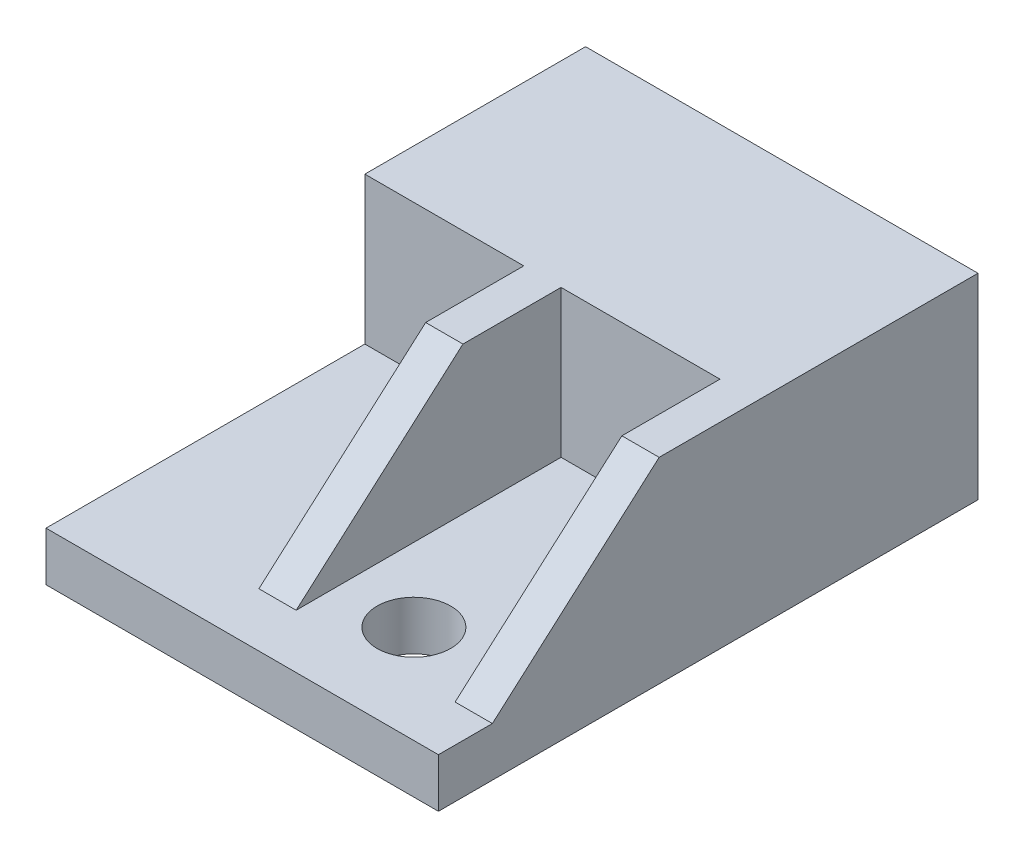
from build123d import *

# Parameters (mm, degrees)
BOSS_EXTRUDE3_DEPTH = 50.8
SKETCH1_7_R         = 9.525
BOSS_EXTRUDE5_DEPTH = 12.7
BOSS_EXTRUDE6_DEPTH = 9.652
SKETCH7_W           = 88.9
SKETCH7_H           = 44.45
CUT_EXTRUDE1_DEPTH  = 44.45
BOSS_EXTRUDE7_DEPTH = 9.652


with BuildPart() as part:
    # Sketch1 → Boss-Extrude3 (new body)
    with BuildSketch(Plane(origin=(0, 0, 0), x_dir=(1, 0, 0), z_dir=(0, 1, 0))):
        Polygon((0, 139.7), (-101.6, 139.7), (-101.6, 82.55), (-60.452, 82.55), (-60.452, 57.15), (-50.8, 57.15), (-50.8, 82.55), (-9.652, 82.55), (-9.652, 57.15), (0, 57.15), (0, 82.55), align=None)
    extrude(amount=BOSS_EXTRUDE3_DEPTH)

    # Sketch1<7> → Boss-Extrude5 (add)
    with BuildSketch(Plane(origin=(0, 0, 0), x_dir=(1, 0, 0), z_dir=(0, 1, 0))):
        Polygon((-60.452, 82.55), (-101.6, 82.55), (-101.6, 0), (0, 0), (0, 57.15), (-9.652, 57.15), (-9.652, 82.55), (-50.8, 82.55), (-50.8, 57.15), (-60.452, 57.15), align=None)
        with Locations((-31.75, 25.4)):
            Circle(SKETCH1_7_R, mode=Mode.SUBTRACT)
    extrude(amount=BOSS_EXTRUDE5_DEPTH)

    # Sketch3 → Boss-Extrude6 (add)
    with BuildSketch(Plane(origin=(0, 0, 0), x_dir=(0, 0, -1), z_dir=(1, 0, 0))):
        Polygon((57.15, 12.7), (13.97, 12.7), (57.15, 50.8), align=None)
    extrude(amount=-BOSS_EXTRUDE6_DEPTH)

    # Sketch7 → Cut-Extrude1 (cut)
    with BuildSketch(Plane.XZ):
        with Locations((-50.8, -117.475)):
            Rectangle(SKETCH7_W, SKETCH7_H)
    extrude(amount=-CUT_EXTRUDE1_DEPTH, mode=Mode.SUBTRACT)

    # Sketch6 → Boss-Extrude7 (add)
    with BuildSketch(Plane(origin=(-50.8, 0, 0), x_dir=(0, 0, -1), z_dir=(1, 0, 0))):
        Polygon((57.15, 12.7), (57.15, 50.8), (13.97, 12.7), align=None)
    extrude(amount=-BOSS_EXTRUDE7_DEPTH)


solid = part.part
